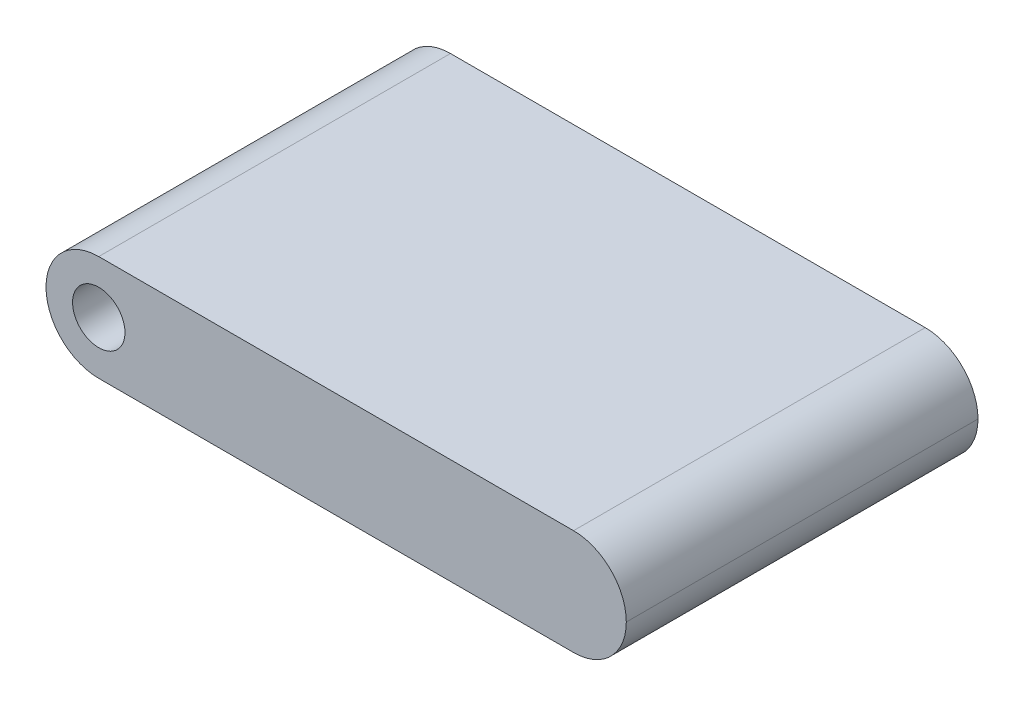
from build123d import *

# Parameters (mm, degrees)
SKETCH1_W           = 66
SKETCH1_H           = 12
SKETCH1_R           = 2.98
BOSS_EXTRUDE1_DEPTH = 20
FILLET2_R           = 6


with BuildPart() as part:
    # Sketch1 → Boss-Extrude1 (new, symmetric)
    with BuildSketch(Plane.XY):
        with Locations((27, 0)):
            Rectangle(SKETCH1_W, SKETCH1_H)
        Circle(SKETCH1_R, mode=Mode.SUBTRACT)
    extrude(amount=BOSS_EXTRUDE1_DEPTH, both=True)

    # Fillet2
    fillet2_edges = [part.edges().sort_by_distance(p)[0] for p in [
        (60, -6, 0),
        (60, 6, 0),
        (-6, -6, 0),
        (-6, 6, 0),
    ]]
    fillet(fillet2_edges, radius=FILLET2_R - 0.0001)  # a hair under: the kernel refuses the full size


solid = part.part
